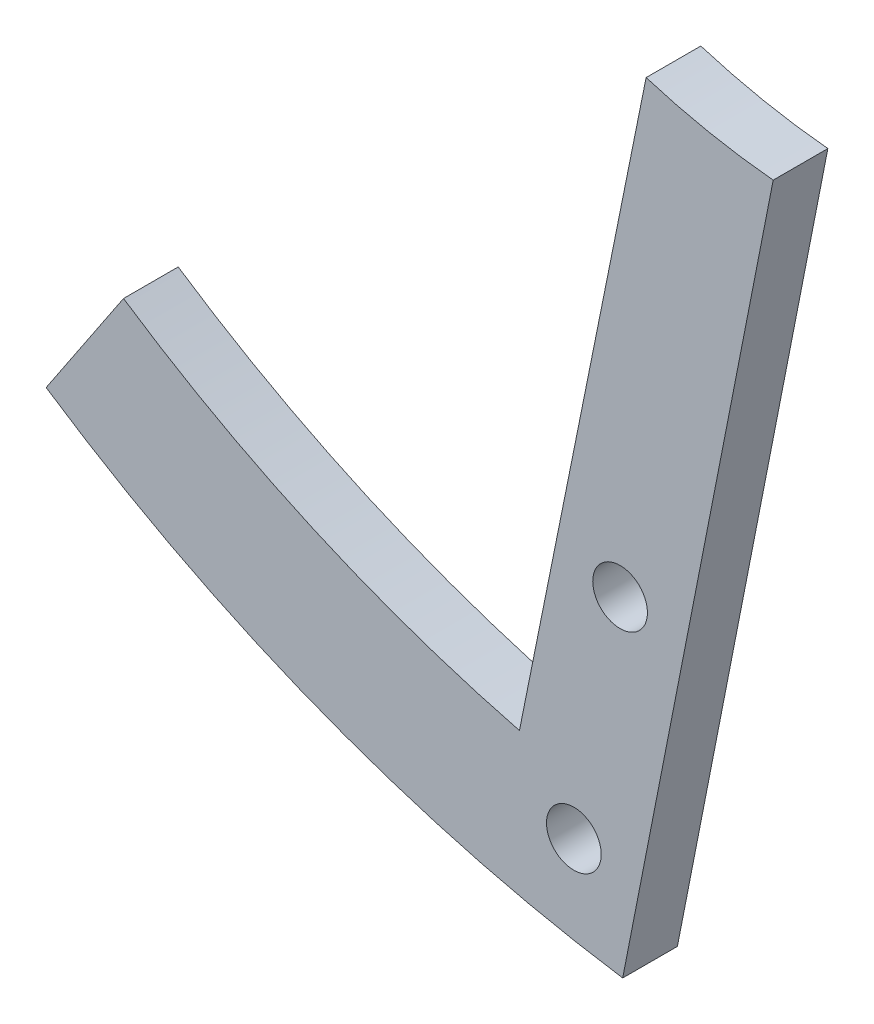
from build123d import *

# Parameters (mm, degrees)
SKETCH_1_R          = 18
LASHENA_DEPTH       = 3
CUT_EXTRUDEA_DEPTH  = 3
WWW_KYTOOL_CN_COUNT = 16
SKETCH_3_R          = 1.5
CUT_EXTRUDE_2_DEPTH = 10
SKETCH_4_R          = 1.5
CUT_EXTRUDE_3_DEPTH = 10
EXTRUDE_1_DEPTH     = 3
SKETCH_6_R          = 1.5
CUT_EXTRUDE_4_DEPTH = 3
SKETCH_7_R          = 35
CUT_EXTRUDE_5_DEPTH = 3


with BuildPart() as part:
    # 草图1 → LaShenA (new body)
    with BuildSketch(Plane.XY):
        Circle(SKETCH_1_R)
    extrude(amount=LASHENA_DEPTH)

    # SketchA → Cut-ExtrudeA (cut)
    with BuildSketch(Plane.XY.offset(3)):
        with BuildLine():
            ThreePointArc((0.423212707, 13.493364703), (0, 13.5), (-0.423212707, 13.493364703))
            ThreePointArc((-0.423212707, 13.493364703), (-0.952770902, 13.685686791), (-1.20440395, 14.18977059))
            add(Edge.make_bspline(
                [(-1.20440395, 14.18977059), (-1.226562505, 14.455224305), (-1.213843633, 14.773889884), (-1.273675597, 15.110607864), (-1.299119688, 15.21139578), (-1.321432077, 15.29109757), (-1.349914152, 15.382250837), (-1.385146673, 15.484587535), (-1.427834192, 15.597770763), (-1.478623281, 15.721446817), (-1.538159915, 15.855229004), (-1.607069773, 15.998703507), (-1.685962928, 16.151428337), (-1.775430978, 16.312934487), (-1.876046532, 16.482726463), (-1.98836201, 16.660283053), (-2.112908684, 16.845058076), (-2.250195688, 17.036481179), (-2.400709063, 17.233958676), (-2.56491084, 17.43687441), (-2.743238138, 17.644590662), (-2.936102365, 17.856449073), (-3.14388814, 18.07177164), (-3.447378451, 18.368492697), (-3.689495989, 18.585006365), (-3.858042439, 18.727457792)],
                knots=[0.122308221, 0.122308221, 0.122308221, 0.122308221, 0.250610689, 0.276296194, 0.287604067, 0.300967916, 0.316387742, 0.333863545, 0.353395324, 0.37498308, 0.398626813, 0.424326522, 0.452082207, 0.48189387, 0.513761509, 0.547685125, 0.583664717, 0.621700286, 0.661791832, 0.703939355, 0.748142854, 0.79440233, 0.842717782, 0.893089212, 1, 1, 1, 1], degree=3))
            ThreePointArc((-3.858042439, 18.727457792), (0, 19.120726106), (3.858042439, 18.727457792))
            add(Edge.make_bspline(
                [(1.20440395, 14.18977059), (1.226562505, 14.455224305), (1.213843633, 14.773889884), (1.273675597, 15.110607864), (1.299119688, 15.21139578), (1.321432077, 15.29109757), (1.349914152, 15.382250837), (1.385146673, 15.484587535), (1.427834192, 15.597770763), (1.478623281, 15.721446817), (1.538159915, 15.855229004), (1.607069773, 15.998703507), (1.685962928, 16.151428337), (1.775430978, 16.312934487), (1.876046532, 16.482726463), (1.98836201, 16.660283053), (2.112908684, 16.845058076), (2.250195688, 17.036481179), (2.400709063, 17.233958676), (2.56491084, 17.43687441), (2.743238138, 17.644590662), (2.936102365, 17.856449073), (3.14388814, 18.07177164), (3.447378451, 18.368492697), (3.689495989, 18.585006365), (3.858042439, 18.727457792)],
                knots=[0.122308221, 0.122308221, 0.122308221, 0.122308221, 0.250610689, 0.276296194, 0.287604067, 0.300967916, 0.316387742, 0.333863545, 0.353395324, 0.37498308, 0.398626813, 0.424326522, 0.452082207, 0.48189387, 0.513761509, 0.547685125, 0.583664717, 0.621700286, 0.661791832, 0.703939355, 0.748142854, 0.79440233, 0.842717782, 0.893089212, 1, 1, 1, 1], degree=3))
            ThreePointArc((1.20440395, 14.18977059), (0.952770902, 13.685686791), (0.423212707, 13.493364703))
        make_face()
    cut_extrudea = extrude(amount=-CUT_EXTRUDEA_DEPTH, mode=Mode.SUBTRACT)

    # www.KYTool.cn: Cut-ExtrudeA ×16 about axis
    www_kytool_cn_axis = Axis((0, 0, -80.9), (0, 0, 1))
    for i in range(1, WWW_KYTOOL_CN_COUNT):
        add(cut_extrudea.rotate(www_kytool_cn_axis, i * 360 / WWW_KYTOOL_CN_COUNT), mode=Mode.SUBTRACT)

    # 草图3 → 切除-拉伸2 (cut)
    with BuildSketch(Plane(origin=(0, 0, 0), x_dir=(-1, 0, 0), z_dir=(0, 0, -1))):
        Circle(SKETCH_3_R)
    extrude(amount=-CUT_EXTRUDE_2_DEPTH, mode=Mode.SUBTRACT)

    # 草图4 → 切除-拉伸3 (cut)
    with BuildSketch(Plane(origin=(0, 0, 0), x_dir=(-1, 0, 0), z_dir=(0, 0, -1))):
        with Locations((5, 0)):
            Circle(SKETCH_4_R)
        with Locations((0, -5)):
            Circle(SKETCH_4_R)
        with Locations((-5, 0)):
            Circle(SKETCH_4_R)
        with Locations((0, 5)):
            Circle(SKETCH_4_R)
    extrude(amount=-CUT_EXTRUDE_3_DEPTH, mode=Mode.SUBTRACT)

    # 草图5 → 凸台-拉伸1 (add)
    with BuildSketch(Plane.XY.offset(3)):
        with BuildLine():
            Line((-3.48199852, -8.406288052), (-6.888301783, -16.629831585))
            Line((-6.888301783, -16.629831585), (-17.226084522, -67.950540756))
            ThreePointArc((-17.226084522, -67.950540756), (-28.498456938, -64.045701878), (-38.945489094, -58.286043408))
            Line((-38.945489094, -58.286043408), (-43.190045675, -64.638471246))
            ThreePointArc((-43.190045675, -64.638471246), (-28.051735714, -72.502497432), (-11.562659331, -76.875333623))
            Line((-11.562659331, -76.875333623), (0, -18))
            Line((0, -18), (0, -9.09890062))
            ThreePointArc((0, -9.09890062), (-1.775107452, -8.924067796), (-3.48199852, -8.406288052))
        make_face()
    extrude(amount=-EXTRUDE_1_DEPTH)

    # 草图6 → 切除-拉伸4 (cut)
    with BuildSketch(Plane(origin=(0, 0, 0), x_dir=(-1, 0, 0), z_dir=(0, 0, -1))):
        with Locations((14.241593507, -71.597325469)):
            Circle(SKETCH_6_R)
        with Locations((11.705419321, -58.847116824)):
            Circle(SKETCH_6_R)
    extrude(amount=-CUT_EXTRUDE_4_DEPTH, mode=Mode.SUBTRACT)

    # 草图7 → 切除-拉伸5 (cut)
    with BuildSketch(Plane(origin=(0, 0, 0), x_dir=(-1, 0, 0), z_dir=(0, 0, -1))):
        Circle(SKETCH_7_R)
    extrude(amount=-CUT_EXTRUDE_5_DEPTH, mode=Mode.SUBTRACT)


solid = part.part
